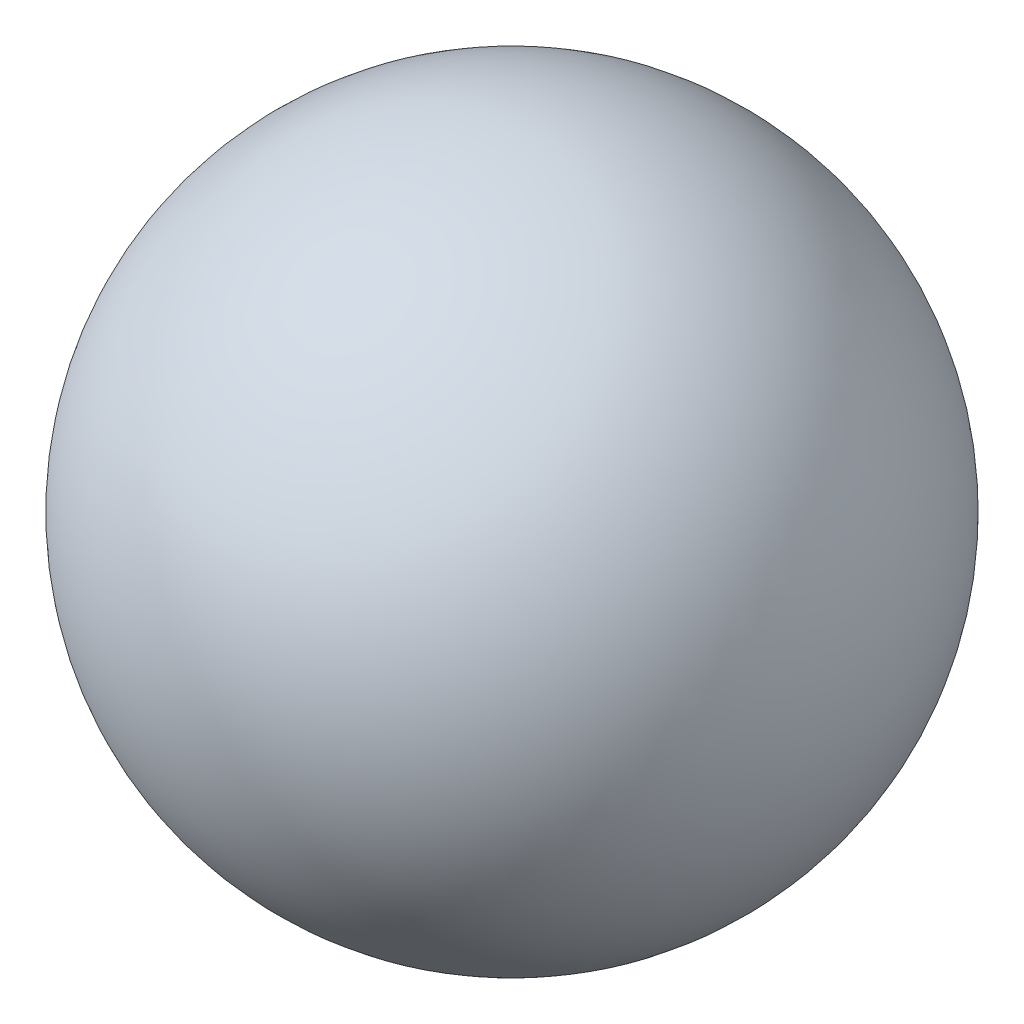
from build123d import *


with BuildPart() as part:
    # Sketch1 → Revolve1 (revolve)
    with BuildSketch(Plane.XY):
        with BuildLine():
            ThreePointArc((0, 20), (-20, 0), (0, -20))
            Line((0, -20), (0, 20))
        make_face()
    revolve(axis=Axis((0, -20, 0), (0, 1, 0)))


solid = part.part
